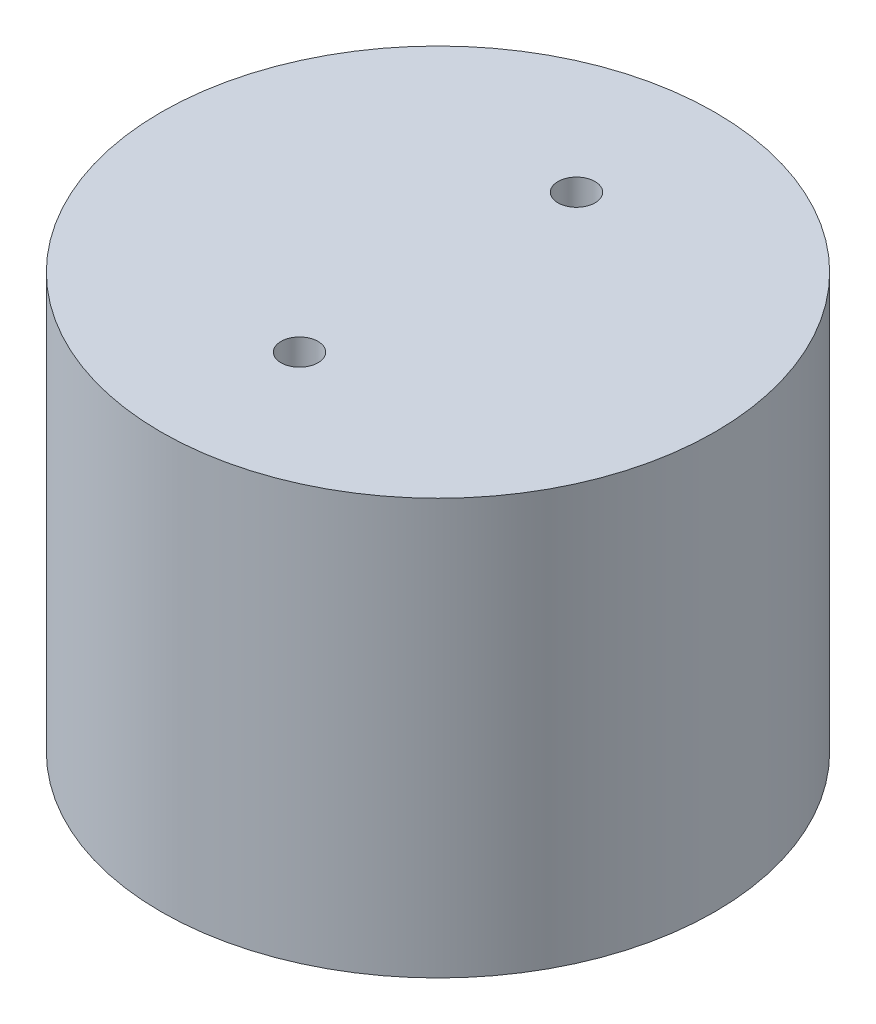
from build123d import *

# Parameters (mm, degrees)
SKETCH1_R                                        = 25.4
BOSS_EXTRUDE1_DEPTH                              = 38.1
F_1_4_20_TAPPED_HOLE4_D                          = 5.1054
F_1_4_20_TAPPED_HOLE4_DEPTH                      = 15.875
F_1_4_20_TAPPED_HOLE4_TIP                        = 1.533816902
CBORE_FOR_M3_HEX_HEAD_MACHINE_SCREW1_D           = 3.4
CBORE_FOR_M3_HEX_HEAD_MACHINE_SCREW1_CBORE_D     = 8.4
CBORE_FOR_M3_HEX_HEAD_MACHINE_SCREW1_CBORE_DEPTH = 2.3


with BuildPart() as part:
    # Sketch1 → Boss-Extrude1 (new body)
    with BuildSketch(Plane(origin=(0, 0, 0), x_dir=(1, 0, 0), z_dir=(0, 1, 0))):
        Circle(SKETCH1_R)
    extrude(amount=BOSS_EXTRUDE1_DEPTH)

    # 1/4-20 Tapped Hole4
    with Locations(Plane(origin=(0, 0, 0), x_dir=(-1, 0, 0), z_dir=(0, -1, 0))):
        with Locations((12.7, 0), (-12.7, 0)):
            Hole(F_1_4_20_TAPPED_HOLE4_D / 2, depth=F_1_4_20_TAPPED_HOLE4_DEPTH)
            with Locations((0, 0, -(F_1_4_20_TAPPED_HOLE4_DEPTH + F_1_4_20_TAPPED_HOLE4_TIP / 2))):  # 118° drill point
                Cone(0, F_1_4_20_TAPPED_HOLE4_D / 2, F_1_4_20_TAPPED_HOLE4_TIP, mode=Mode.SUBTRACT)

    # CBORE for M3 Hex Head Machine Screw1 (through all)
    with Locations(Plane(origin=(0, 0, 0), x_dir=(-1, 0, 0), z_dir=(0, -1, 0))):
        with Locations((0, -12.7), (0, 12.7)):
            CounterBoreHole(CBORE_FOR_M3_HEX_HEAD_MACHINE_SCREW1_D / 2, CBORE_FOR_M3_HEX_HEAD_MACHINE_SCREW1_CBORE_D / 2, CBORE_FOR_M3_HEX_HEAD_MACHINE_SCREW1_CBORE_DEPTH)


solid = part.part
